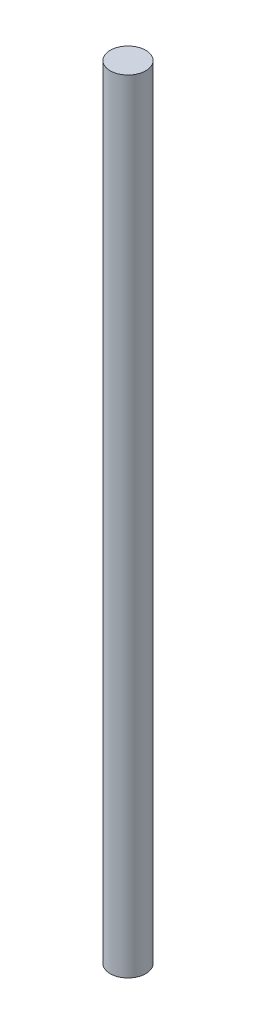
from build123d import *

# Parameters (mm, degrees)
SKETCH1_R           = 2.5
BOSS_EXTRUDE1_DEPTH = 55


with BuildPart() as part:
    # Sketch1 → Boss-Extrude1 (new, symmetric)
    with BuildSketch(Plane(origin=(0, 0, 0), x_dir=(1, 0, 0), z_dir=(0, 1, 0))):
        Circle(SKETCH1_R)
    extrude(amount=BOSS_EXTRUDE1_DEPTH, both=True)


solid = part.part
